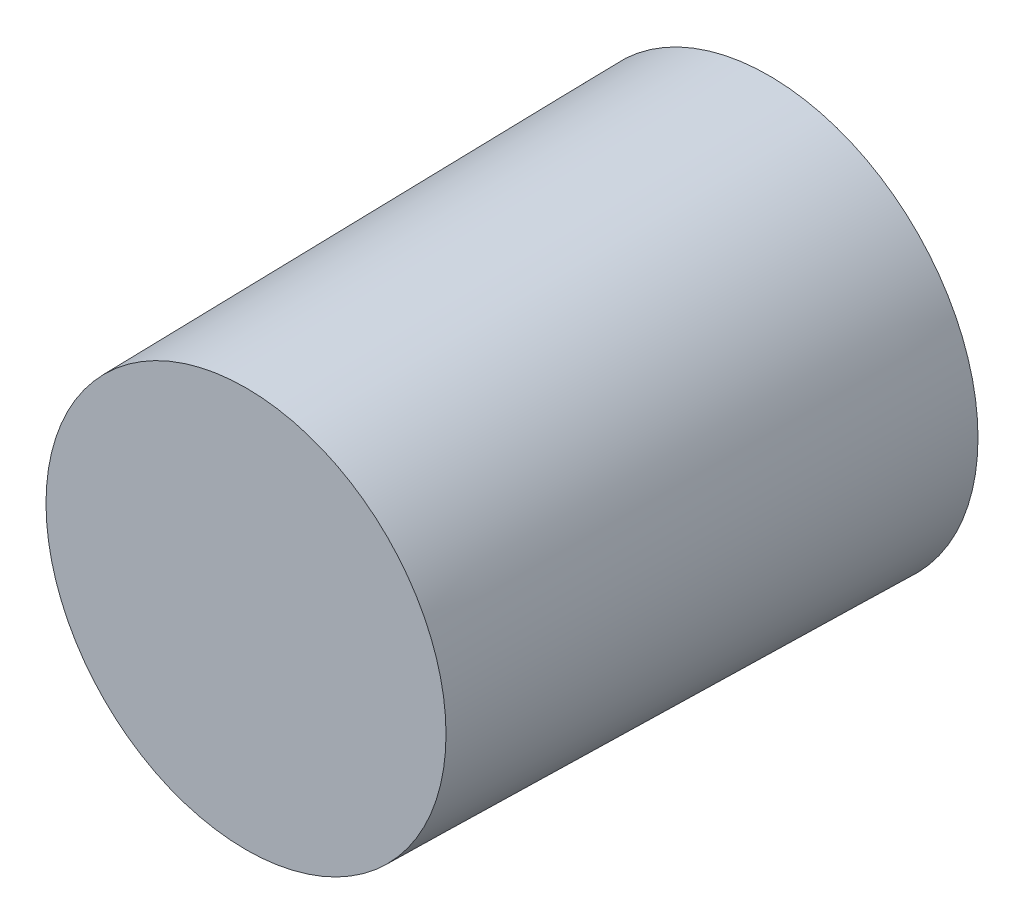
from build123d import *

# Parameters (mm, degrees)
BASE_R         = 10
CYLINDER_DEPTH = 25
CYLINDER_TAPER = 1
KEY_SLOT_DEPTH = 2


# Read off the part's stored shape, not the designer's step: key slot
with BuildPart() as part:
    # base → cylinder (new body)
    with BuildSketch(Plane.XY):
        Circle(BASE_R)
    extrude(amount=CYLINDER_DEPTH, taper=CYLINDER_TAPER)

    # key slot outline → key slot (cut)
    with BuildSketch(Plane.XY):
        with BuildLine():
            Line((-2.5, 2.5), (-2.5, -2.5))
            ThreePointArc((-2.5, -2.5), (0, -5), (2.5, -2.5))
            Line((2.5, -2.5), (2.5, 2.5))
            ThreePointArc((2.5, 2.5), (0, 5), (-2.5, 2.5))
        make_face()
    extrude(amount=KEY_SLOT_DEPTH, mode=Mode.SUBTRACT)


solid = part.part
